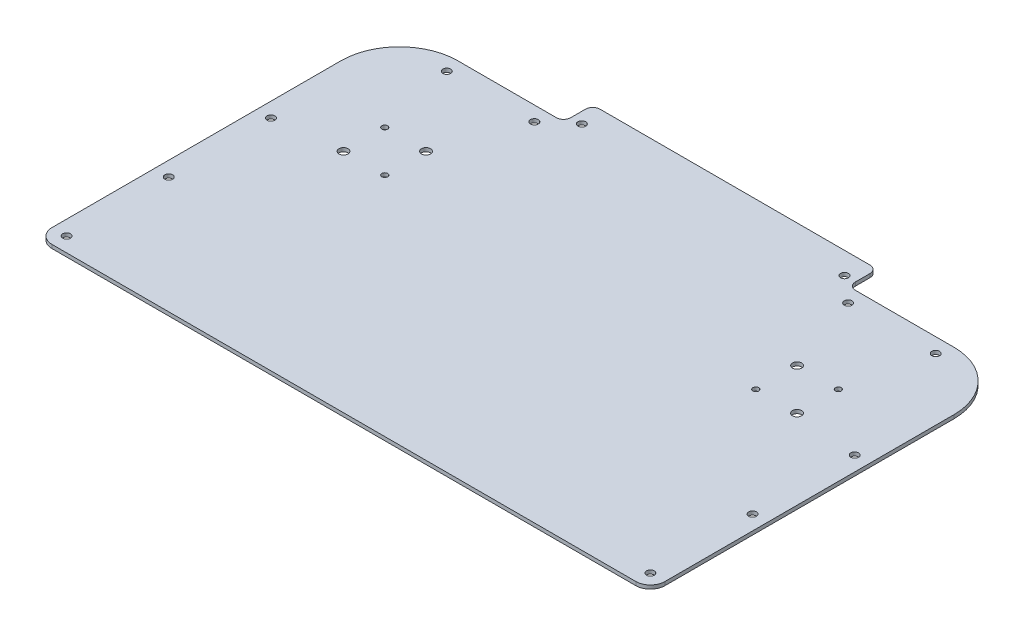
from build123d import *

# Parameters (mm, degrees)
BOSS_EXTRUDE1_DEPTH = 3.175
SKETCH3_R           = 3.3782
CUT_EXTRUDE1_DEPTH  = 433.416350552
CUT_EXTRUDE2_DEPTH  = 433.416350552
CUT_EXTRUDE3_DEPTH  = 433.416350552
FILLET1_R           = 50.8
FILLET2_R           = 6.35
FILLET3_R           = 12.7
FILLET4_R           = 6.35
SKETCH7_R           = 3.3782
CUT_EXTRUDE4_DEPTH  = 433.416350552


with BuildPart() as part:
    # Sketch2 → Boss-Extrude1 (new body)
    with BuildSketch(Plane(origin=(0, 0, 0), x_dir=(1, 0, 0), z_dir=(0, 1, 0))):
        Polygon((-266.7, -25.4), (-266.7, -340.36), (266.7, -340.36), (266.7, -25.4), (123.825, -25.4), (123.825, 0), (-123.825, 0), (-123.825, -25.4), align=None)
    extrude(amount=BOSS_EXTRUDE1_DEPTH)

    # Sketch3 → Cut-Extrude1 (cut, through all)
    with BuildSketch(Plane(origin=(0, 3.175, 0), x_dir=(1, 0, 0), z_dir=(0, 1, 0))):
        with Locations((-114.3, -19.05)):
            Circle(SKETCH3_R)
        with Locations((114.3, -19.05)):
            Circle(SKETCH3_R)
    extrude(amount=-CUT_EXTRUDE1_DEPTH, mode=Mode.SUBTRACT)

    # Sketch4 → Cut-Extrude2 (cut, through all)
    with BuildSketch(Plane(origin=(0, 3.175, 0), x_dir=(1, 0, 0), z_dir=(0, 1, 0))):
        with BuildLine():
            ThreePointArc((-195.827786491, -147.039057827), (-193.681966657, -141.852786491), (-198.868237993, -139.706966657))
            ThreePointArc((-198.868237993, -139.706966657), (-201.014057827, -144.893237993), (-195.827786491, -147.039057827))
        make_face()
        with BuildLine():
            ThreePointArc((-161.426987758, -145.925712242), (-158.874287758, -143.373012242), (-161.426987758, -140.820312242))
            ThreePointArc((-161.426987758, -140.820312242), (-163.979687758, -143.373012242), (-161.426987758, -145.925712242))
        make_face()
        with BuildLine():
            ThreePointArc((-197.348012242, -110.004687758), (-194.795312242, -107.451987758), (-197.348012242, -104.899287758))
            ThreePointArc((-197.348012242, -104.899287758), (-199.900712242, -107.451987758), (-197.348012242, -110.004687758))
        make_face()
        with BuildLine():
            ThreePointArc((-159.906762007, -111.118033343), (-157.760942173, -105.931762007), (-162.947213509, -103.785942173))
            ThreePointArc((-162.947213509, -103.785942173), (-165.093033343, -108.972213509), (-159.906762007, -111.118033343))
        make_face()
    extrude(amount=-CUT_EXTRUDE2_DEPTH, mode=Mode.SUBTRACT)

    # Sketch6 → Cut-Extrude3 (cut, through all)
    with BuildSketch(Plane(origin=(0, 3.175, 0), x_dir=(1, 0, 0), z_dir=(0, 1, 0))):
        with BuildLine():
            ThreePointArc((201.014057827, -141.852786491), (195.827786491, -139.706966657), (193.681966657, -144.893237993))
            ThreePointArc((193.681966657, -144.893237993), (198.868237993, -147.039057827), (201.014057827, -141.852786491))
        make_face()
        with BuildLine():
            ThreePointArc((157.760942173, -108.972213509), (162.947213509, -111.118033343), (165.093033343, -105.931762007))
            ThreePointArc((165.093033343, -105.931762007), (159.906762007, -103.785942173), (157.760942173, -108.972213509))
        make_face()
        with BuildLine():
            ThreePointArc((199.900712242, -107.451987758), (197.348012242, -104.899287758), (194.795312242, -107.451987758))
            ThreePointArc((194.795312242, -107.451987758), (197.348012242, -110.004687758), (199.900712242, -107.451987758))
        make_face()
        with BuildLine():
            ThreePointArc((158.874287758, -143.373012242), (161.426987758, -145.925712242), (163.979687758, -143.373012242))
            ThreePointArc((163.979687758, -143.373012242), (161.426987758, -140.820312242), (158.874287758, -143.373012242))
        make_face()
    extrude(amount=-CUT_EXTRUDE3_DEPTH, mode=Mode.SUBTRACT)

    # Fillet1
    fillet1_edges = [part.edges().sort_by_distance(p)[0] for p in [
        (-266.7, 1.5875, 25.4),
        (266.7, 1.5875, 25.4),
    ]]
    fillet(fillet1_edges, radius=FILLET1_R)

    # Fillet2
    fillet2_edges = [part.edges().sort_by_distance(p)[0] for p in [
        (-123.825, 1.5875, 25.4),
        (123.825, 1.5875, 25.4),
    ]]
    fillet(fillet2_edges, radius=FILLET2_R)

    # Fillet3
    fillet3_edges = [part.edges().sort_by_distance(p)[0] for p in [
        (266.7, 1.5875, 340.36),
        (-266.7, 1.5875, 340.36),
    ]]
    fillet(fillet3_edges, radius=FILLET3_R)

    # Fillet4
    fillet4_edges = [part.edges().sort_by_distance(p)[0] for p in [
        (123.825, 1.5875, 0),
        (-123.825, 1.5875, 0),
    ]]
    fillet(fillet4_edges, radius=FILLET4_R)

    # Sketch7 → Cut-Extrude4 (cut, through all)
    with BuildSketch(Plane(origin=(0, 3.175, 0), x_dir=(1, 0, 0), z_dir=(0, 1, 0))):
        with Locations((-254, -327.66)):
            Circle(SKETCH7_R)
        with Locations((-254, -238.76)):
            Circle(SKETCH7_R)
        with Locations((-254, -149.86)):
            Circle(SKETCH7_R)
        with Locations((-136.525, -38.1)):
            Circle(SKETCH7_R)
        with Locations((-212.725, -38.1)):
            Circle(SKETCH7_R)
        with Locations((254, -327.66)):
            Circle(SKETCH7_R)
        with Locations((254, -238.76)):
            Circle(SKETCH7_R)
        with Locations((254, -149.86)):
            Circle(SKETCH7_R)
        with Locations((212.725, -38.1)):
            Circle(SKETCH7_R)
        with Locations((136.525, -38.1)):
            Circle(SKETCH7_R)
    extrude(amount=-CUT_EXTRUDE4_DEPTH, mode=Mode.SUBTRACT)


solid = part.part
